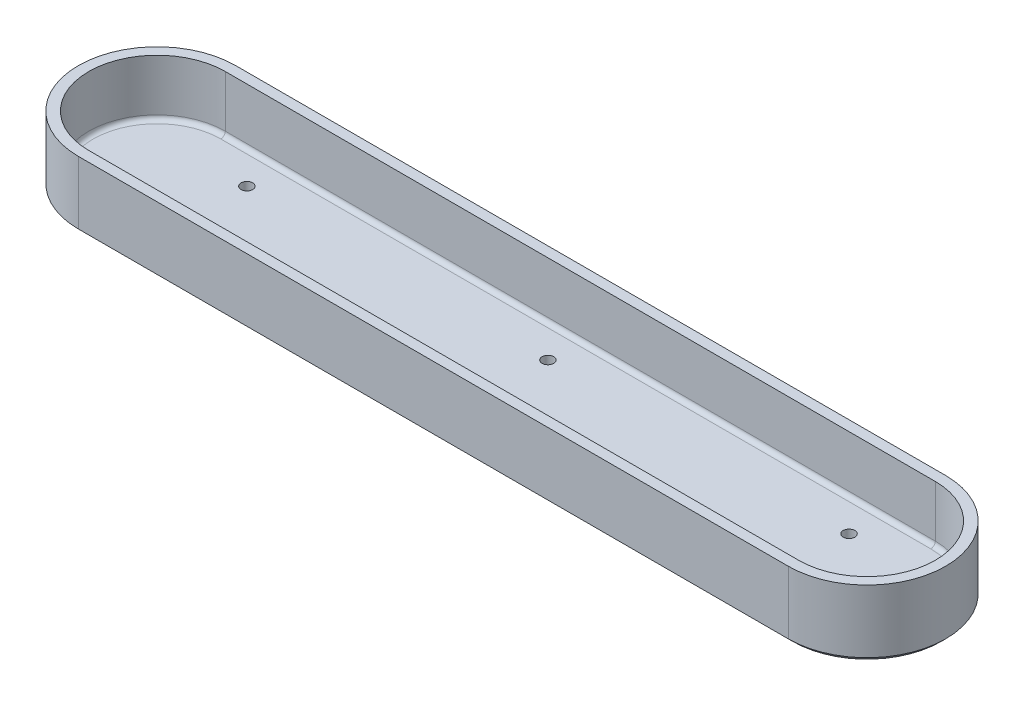
from build123d import *

# Parameters (mm, degrees)
MAINBLOCK_DEPTH     = 3.175
BOSS_EXTRUDE1_DEPTH = 19.05
SKETCH3_R           = 1.651
MOUNT_HOLES_DEPTH   = 127.00230613
FILLET1_R           = 1.27
CHAMFER1_SIZE       = 1.27


with BuildPart() as part:
    # Sketch1 → MainBlock (new body)
    with BuildSketch(Plane(origin=(0, 0, 0), x_dir=(1, 0, 0), z_dir=(0, 1, 0))):
        with BuildLine():
            Line((-100.33, 19.304), (100.33, 19.304))
            ThreePointArc((100.33, 19.304), (119.634, 0), (100.33, -19.304))
            Line((100.33, -19.304), (-100.33, -19.304))
            ThreePointArc((-100.33, -19.304), (-119.634, 0), (-100.33, 19.304))
        make_face()
    extrude(amount=MAINBLOCK_DEPTH)

    # Sketch2 → Boss-Extrude1 (add)
    with BuildSketch(Plane.XZ):
        with BuildLine():
            Line((-100.33, 22.225), (100.33, 22.225))
            ThreePointArc((100.33, 22.225), (122.555, 0), (100.33, -22.225))
            Line((100.33, -22.225), (-100.33, -22.225))
            ThreePointArc((-100.33, -22.225), (-122.555, 0), (-100.33, 22.225))
        make_face()
        with BuildLine():
            Line((100.33, 19.304), (-100.33, 19.304))
            ThreePointArc((-100.33, 19.304), (-119.634, 0), (-100.33, -19.304))
            Line((-100.33, -19.304), (100.33, -19.304))
            ThreePointArc((100.33, -19.304), (119.634, 0), (100.33, 19.304))
        make_face(mode=Mode.SUBTRACT)
    extrude(amount=-BOSS_EXTRUDE1_DEPTH)

    # Sketch3 → Mount-Holes (cut, through all)
    with BuildSketch(Plane.XZ):
        with Locations((0, 10.16)):
            Circle(SKETCH3_R)
        with Locations((-85.09, 10.16)):
            Circle(SKETCH3_R)
        with Locations((85.09, 10.16)):
            Circle(SKETCH3_R)
        with Locations((85.09, -10.16)):
            Circle(SKETCH3_R)
        with Locations((-85.09, -10.16)):
            Circle(SKETCH3_R)
        with Locations((0, -10.16)):
            Circle(SKETCH3_R)
    extrude(amount=-MOUNT_HOLES_DEPTH, mode=Mode.SUBTRACT)

    # Fillet1
    fillet1_edges = [part.edges().sort_by_distance(p)[0] for p in [
        (119.634, 3.175, 0),
        (0, 3.175, 19.304),
        (-119.634, 3.175, 0),
        (0, 3.175, -19.304),
    ]]
    fillet(fillet1_edges, radius=FILLET1_R)

    # Chamfer1
    chamfer1_edges = [part.edges().sort_by_distance(p)[0] for p in [
        (0, 0, 22.225),
        (-122.555, 0, 0),
        (122.555, 0, 0),
        (0, 0, -22.225),
    ]]
    chamfer(chamfer1_edges, length=CHAMFER1_SIZE)


solid = part.part
